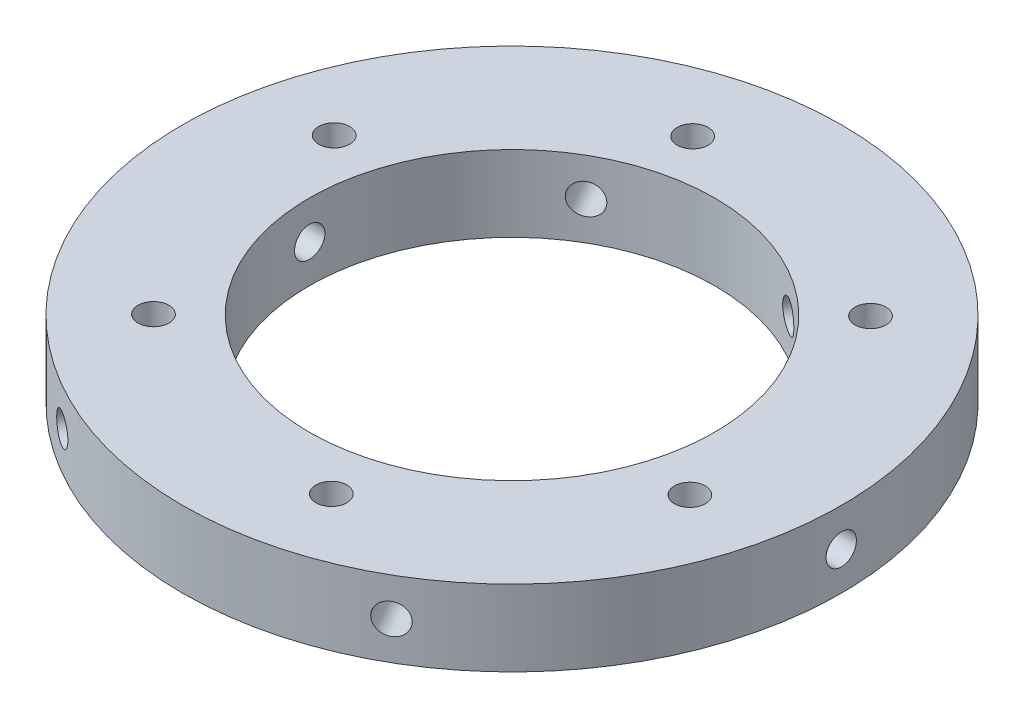
from build123d import *

# Parameters (mm, degrees)
SKETCH1_R             = 65
SKETCH1_R_2           = 40
SKETCH1_R_3           = 3.05
BOSS_EXTRUDE1_DEPTH   = 15
SKETCH2_R             = 3
CUT_EXTRUDE1_DEPTH    = 94.139680051
CIRPATTERN1_COUNT     = 6
CIRPATTERN2_OUTLINE_R = 3.05
CIRPATTERN2_DEPTH     = 15


# Read off the part's stored shape, not the designer's step: CirPattern2
with BuildPart() as part:
    # Sketch1 → Boss-Extrude1 (new body)
    with BuildSketch(Plane(origin=(0, 0, 0), x_dir=(1, 0, 0), z_dir=(0, 1, 0))):
        with Locations(Location((0, 0, 0), (0, 0, 270))):
            Circle(SKETCH1_R)
        with Locations(Location((0, 0, 0), (0, 0, 270))):
            Circle(SKETCH1_R_2, mode=Mode.SUBTRACT)
        with Locations(Location((12.723046489, -48.354152749, 0), (0, 0, 270))):
            Circle(SKETCH1_R_3, mode=Mode.SUBTRACT)
    extrude(amount=BOSS_EXTRUDE1_DEPTH)

    # Sketch2 → Cut-Extrude1 (cut, through all)
    with BuildSketch(Plane(origin=(0, 0, 0), x_dir=(0, 0, -1), z_dir=(1, 0, 0))):
        with Locations((0, 7.5)):
            Circle(SKETCH2_R)
    cut_extrude1 = extrude(amount=-CUT_EXTRUDE1_DEPTH, mode=Mode.SUBTRACT)

    # CirPattern1: Cut-Extrude1 ×6 about axis
    cirpattern1_axis = Axis((0, 15, 0), (0, 1, 0))
    for i in range(1, CIRPATTERN1_COUNT):
        add(cut_extrude1.rotate(cirpattern1_axis, i * 360 / CIRPATTERN1_COUNT), mode=Mode.SUBTRACT)

    # CirPattern2 outline → CirPattern2 (cut)
    with BuildSketch(Plane(origin=(0, 0, 0), x_dir=(1, 0, 0), z_dir=(0, 1, 0))):
        with Locations((-35.514401414, -35.195557847)):
            Circle(CIRPATTERN2_OUTLINE_R)
        with Locations((-48.237447903, 13.158594901)):
            Circle(CIRPATTERN2_OUTLINE_R)
        with Locations((-12.723046489, 48.354152749)):
            Circle(CIRPATTERN2_OUTLINE_R)
        with Locations((35.514401414, 35.195557847)):
            Circle(CIRPATTERN2_OUTLINE_R)
        with Locations((48.237447903, -13.158594901)):
            Circle(CIRPATTERN2_OUTLINE_R)
    extrude(amount=CIRPATTERN2_DEPTH, mode=Mode.SUBTRACT)


solid = part.part
